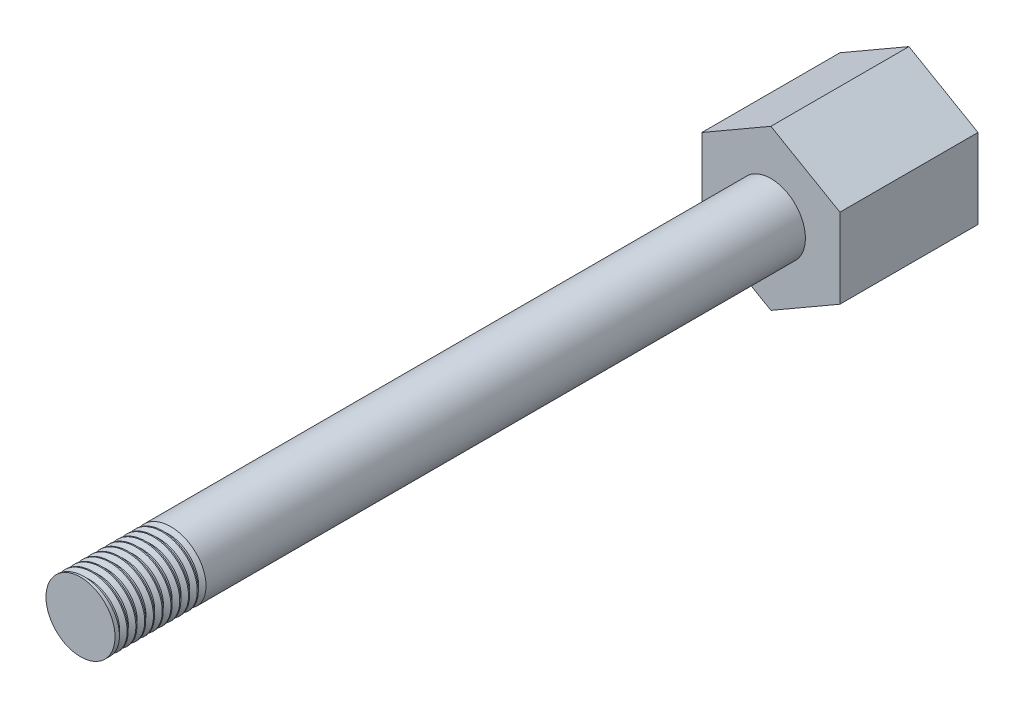
from build123d import *

# Parameters (mm, degrees)
BOSS_EXTRUDE1_DEPTH = 10
SKETCH2_R           = 2.5
BOSS_EXTRUDE2_DEPTH = 50
THREAD1_PITCH       = 0.635


with BuildPart() as part:
    # Sketch1 → Boss-Extrude1 (new body)
    with BuildSketch(Plane.XY):
        Polygon((0, -5.773502692), (5, -2.886751346), (5, 2.886751346), (0, 5.773502692), (-5, 2.886751346), (-5, -2.886751346), align=None)
    extrude(amount=BOSS_EXTRUDE1_DEPTH)

    # Sketch2 → Boss-Extrude2 (add)
    with BuildSketch(Plane.XY.offset(10)):
        Circle(SKETCH2_R)
    extrude(amount=BOSS_EXTRUDE2_DEPTH)

    # Thread1: the profile of Thread Profile1 profile screwed along a right-hand helix of 10 turns, 6 arcs to a turn; built about Z, then put on its axis
    thread1_z = Axis((0, 0, 0), (0, 0, 1))
    thread1_corners = [(2.5003, 0, -0.000173205), (2.5003, 0, 0.555798203), (2.156296169, 0, 0.357187499), (2.156296169, 0, 0.198437499)]
    with BuildLine(mode=Mode.PRIVATE) as thread1_profile:
        Line(thread1_corners[0], thread1_corners[1])
        Line(thread1_corners[1], thread1_corners[2])
        Line(thread1_corners[2], thread1_corners[3])
        Line(thread1_corners[3], thread1_corners[0])
    thread1_cap = Face(thread1_profile.wire())
    thread1_turn_angles = [0, 30, 60, 90, 120, 150, 180, 210, 240, 270, 300, 330, 360]
    thread1_turn_weights = [1, 0.8660254037844387, 1, 0.8660254037844387, 1, 0.8660254037844387, 1, 0.8660254037844387, 1, 0.8660254037844387, 1, 0.8660254037844387, 1]
    thread1_turn_rails = [Edge.make_bspline([Vector(p[0], p[1], 0).rotate(thread1_z, thread1_turn_angles[k]) / thread1_turn_weights[k] + Vector(0, 0, p[2] + THREAD1_PITCH * thread1_turn_angles[k] / 360) for k in range(13)], [0, 0, 0, 1, 1, 2, 2, 3, 3, 4, 4, 5, 5, 6, 6, 6], 2, thread1_turn_weights) for p in thread1_corners]
    thread1_turn_sides = [Face.make_surface_from_curves(thread1_turn_rails[p[0]], thread1_turn_rails[p[1]]) for p in [(0, 1), (1, 2), (2, 3), (3, 0)]]
    thread1 = Plane(origin=(0, 0, 60), x_dir=(-1, 0, 0), z_dir=(0, 0, -1)) * Solid(Shell([*[p.moved(Location((0, 0, THREAD1_PITCH * i))) for i in range(10) for p in thread1_turn_sides], thread1_cap, thread1_cap.rotate(thread1_z, 3600).moved(Location((0, 0, THREAD1_PITCH * 3600 / 360)))]))
    add(thread1, mode=Mode.SUBTRACT)


solid = part.part
